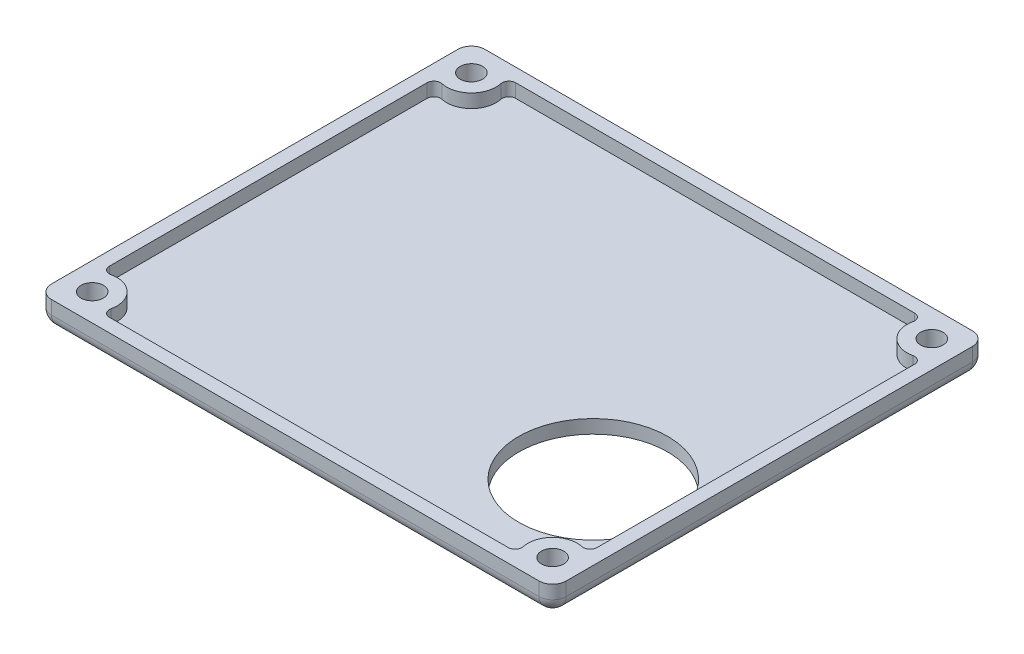
from build123d import *

# Parameters (mm, degrees)
SCHIZZO1_W                   = 76
SCHIZZO1_H                   = 64
ESTRUSIONE_ESTRUSIONE1_DEPTH = 4
SCHIZZO2_W                   = 72
SCHIZZO2_H                   = 60
TAGLIO_ESTRUSIONE1_DEPTH     = 2
SCHIZZO3_R                   = 3.65
SCHIZZO3_R_2                 = 1.65
ESTRUSIONE_ESTRUSIONE2_DEPTH = 2
SCHIZZO3_11_R                = 1.65
TAGLIO_ESTRUSIONE4_DEPTH     = 50.719211579
SCHIZZO5_R                   = 11
TAGLIO_ESTRUSIONE5_DEPTH     = 2
RACCORDO1_R                  = 1
RACCORDO2_R                  = 2


with BuildPart() as part:
    # Schizzo1 → Estrusione-Estrusione1 (new body)
    with BuildSketch(Plane(origin=(0, 0, 0), x_dir=(1, 0, 0), z_dir=(0, 1, 0))):
        Rectangle(SCHIZZO1_W, SCHIZZO1_H)
    extrude(amount=ESTRUSIONE_ESTRUSIONE1_DEPTH)

    # Schizzo2 → Taglio-Estrusione1 (cut)
    with BuildSketch(Plane(origin=(0, 4, 0), x_dir=(1, 0, 0), z_dir=(0, 1, 0))):
        Rectangle(SCHIZZO2_W, SCHIZZO2_H)
    extrude(amount=-TAGLIO_ESTRUSIONE1_DEPTH, mode=Mode.SUBTRACT)

    # Schizzo3 → Estrusione-Estrusione2 (add)
    # profile 1 of 4: a face of its own
    with BuildSketch(Plane(origin=(0, 2, 0), x_dir=(1, 0, 0), z_dir=(0, 1, 0))):
        with Locations((34, 28)):
            Circle(SCHIZZO3_R)
        with Locations(Location((34, 28, 0), (0, 0, 270))):
            Circle(SCHIZZO3_R_2, mode=Mode.SUBTRACT)
    # profile 2 of 4: a face of its own
    with BuildSketch(Plane(origin=(0, 2, 0), x_dir=(1, 0, 0), z_dir=(0, 1, 0))):
        with Locations((-34, 28)):
            Circle(SCHIZZO3_R)
        with Locations(Location((-34, 28, 0), (0, 0, 270))):
            Circle(SCHIZZO3_R_2, mode=Mode.SUBTRACT)
    # profile 3 of 4: a face of its own
    with BuildSketch(Plane(origin=(0, 2, 0), x_dir=(1, 0, 0), z_dir=(0, 1, 0))):
        with Locations((34, -28)):
            Circle(SCHIZZO3_R)
        with Locations(Location((34, -28, 0), (0, 0, 270))):
            Circle(SCHIZZO3_R_2, mode=Mode.SUBTRACT)
    # profile 4 of 4: a face of its own
    with BuildSketch(Plane(origin=(0, 2, 0), x_dir=(1, 0, 0), z_dir=(0, 1, 0))):
        with Locations((-34, -28)):
            Circle(SCHIZZO3_R)
        with Locations(Location((-34, -28, 0), (0, 0, 270))):
            Circle(SCHIZZO3_R_2, mode=Mode.SUBTRACT)
    extrude(amount=ESTRUSIONE_ESTRUSIONE2_DEPTH)

    # Schizzo3<11> → Taglio-Estrusione4 (cut, through all)
    with BuildSketch(Plane(origin=(0, 2, 0), x_dir=(1, 0, 0), z_dir=(0, 1, 0))):
        with Locations(Location((-34, 28, 0), (0, 0, 270))):
            Circle(SCHIZZO3_11_R)
        with Locations(Location((-34, -28, 0), (0, 0, 270))):
            Circle(SCHIZZO3_11_R)
        with Locations(Location((34, -28, 0), (0, 0, 270))):
            Circle(SCHIZZO3_11_R)
        with Locations(Location((34, 28, 0), (0, 0, 270))):
            Circle(SCHIZZO3_11_R)
    extrude(amount=-TAGLIO_ESTRUSIONE4_DEPTH, mode=Mode.SUBTRACT)

    # Schizzo5 → Taglio-Estrusione5 (cut)
    with BuildSketch(Plane.XZ):
        with Locations(Location((25, 13, 0), (0, 0, 270))):
            Circle(SCHIZZO5_R)
    extrude(amount=-TAGLIO_ESTRUSIONE5_DEPTH, mode=Mode.SUBTRACT)

    # Raccordo1
    raccordo1_edges = [part.edges().sort_by_distance(p)[0] for p in [
        (30.946723072, 3, -30),
        (36, 3, -24.946723072),
        (-36, 3, -24.946723072),
        (-30.946723072, 3, -30),
        (-30.946723072, 3, 30),
        (-36, 3, 24.946723072),
        (36, 3, 24.946723072),
        (30.946723072, 3, 30),
    ]]
    fillet(raccordo1_edges, radius=RACCORDO1_R)

    # Raccordo2
    raccordo2_edges = [part.edges().sort_by_distance(p)[0] for p in [
        (0, 0, 32),
        (-38, 0, 0),
        (0, 0, -32),
        (38, 0, 0),
        (38, 2, 32),
        (-38, 2, 32),
        (-38, 2, -32),
        (38, 2, -32),
    ]]
    fillet(raccordo2_edges, radius=RACCORDO2_R - 0.0001)  # a hair under: the kernel refuses the full size


solid = part.part
